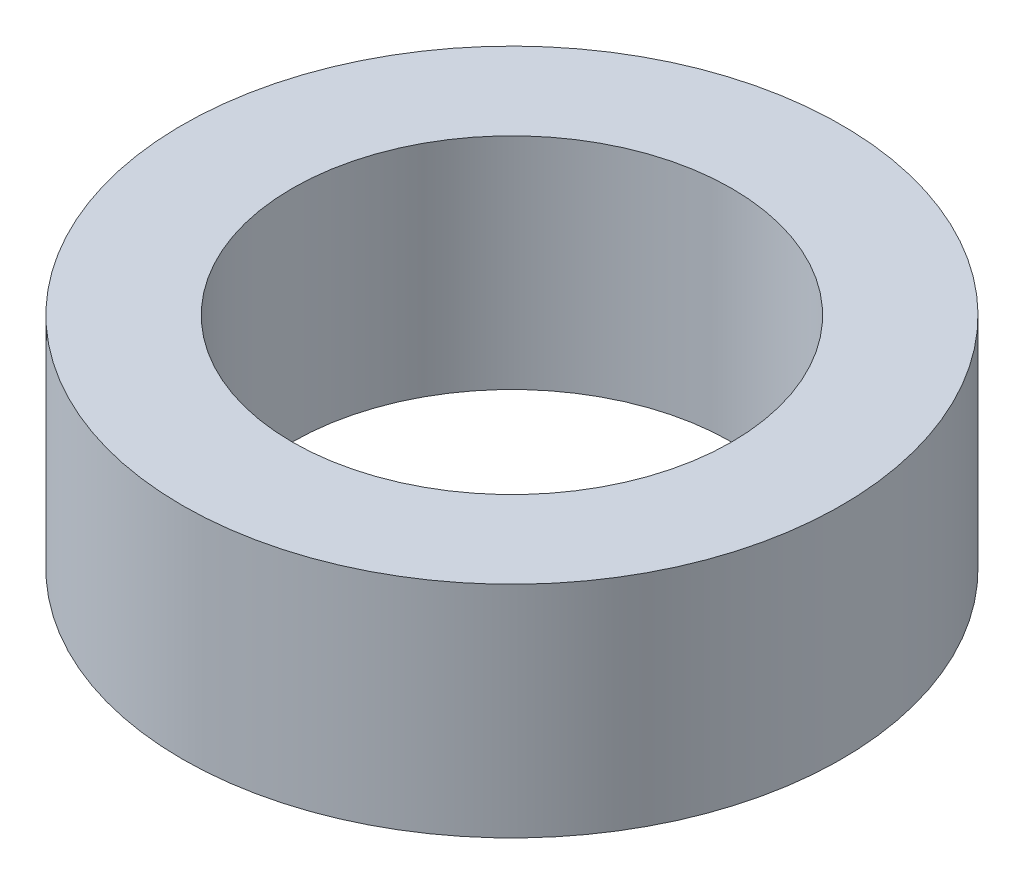
from build123d import *

# Parameters (mm, degrees)
SKIZZE1_R                       = 7.5
SKIZZE1_R_2                     = 5
AUFSATZ_LINEAR_AUSTRAGEN1_DEPTH = 5


with BuildPart() as part:
    # Skizze1 → Aufsatz-Linear austragen1 (new body)
    with BuildSketch(Plane(origin=(0, 0, 0), x_dir=(1, 0, 0), z_dir=(0, 1, 0))):
        Circle(SKIZZE1_R)
        Circle(SKIZZE1_R_2, mode=Mode.SUBTRACT)
    extrude(amount=AUFSATZ_LINEAR_AUSTRAGEN1_DEPTH)


solid = part.part
